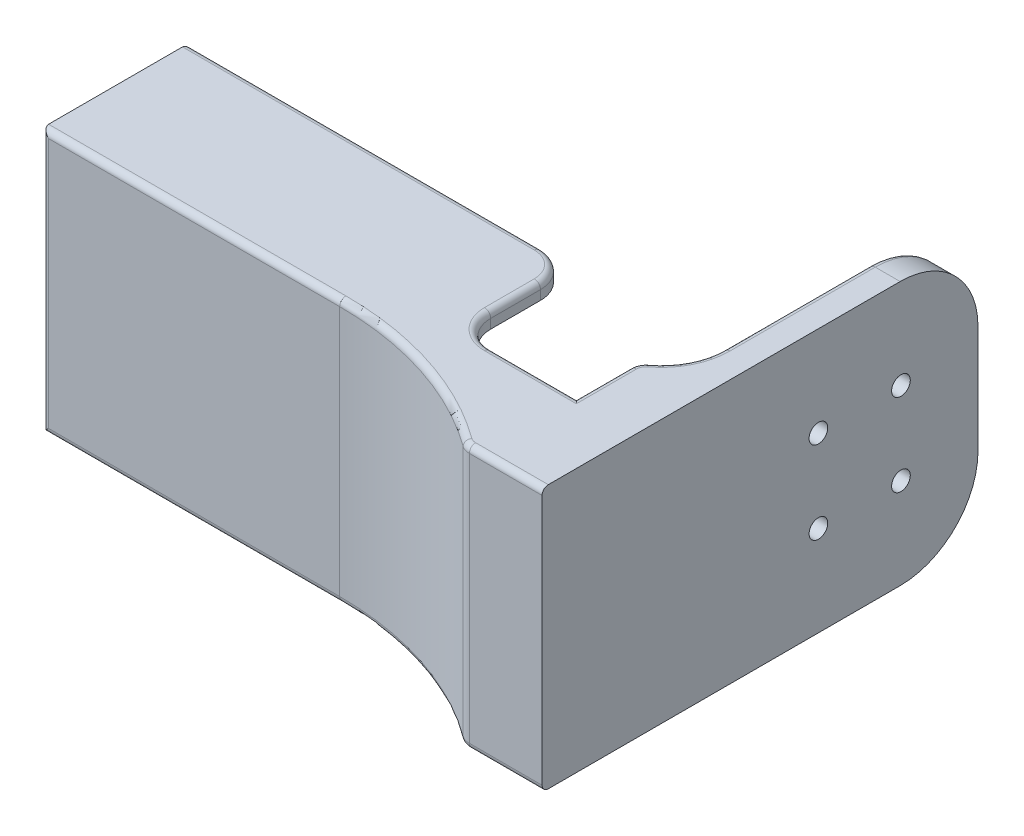
from build123d import *

# Parameters (mm, degrees)
CROQUIS1_W               = 118
CROQUIS1_H               = 84.6
SALIENTE_EXTRUIR1_DEPTH  = 36
CROQUIS2_W               = 36
CROQUIS2_H               = 74.6
CORTAR_EXTRUIR1_DEPTH    = 120
CORTAR_EXTRUIR3_DEPTH    = 110.243581047
SALIENTE_EXTRUIR2_DEPTH  = 84.6
CROQUIS8_W               = 160.5
CROQUIS8_H               = 84.6
SALIENTE_EXTRUIR3_DEPTH  = 5
CROQUIS9_W               = 41
CROQUIS9_H               = 84.6
SALIENTE_EXTRUIR4_DEPTH  = 5
CROQUIS10_W              = 5
CROQUIS10_H              = 84.6
SALIENTE_EXTRUIR5_DEPTH  = 20
REDONDEO2_R              = 10
REDONDEO4_R              = 2
CROQUIS18_W              = 165.5
CROQUIS18_H              = 84.6
SALIENTE_EXTRUIR9_DEPTH  = 6
CROQUIS23_W              = 31
CROQUIS23_H              = 84.6
SALIENTE_EXTRUIR12_DEPTH = 5
CROQUIS19_W              = 120
CROQUIS19_H              = 84.6
SALIENTE_EXTRUIR10_DEPTH = 10
REDONDEO6_R              = 20
REDONDEO9_R              = 5
CROQUIS22_W              = 25
CROQUIS22_H              = 84.6
SALIENTE_EXTRUIR11_DEPTH = 20
REDONDEO7_R              = 100
REDONDEO10_R             = 5
CROQUIS26_R              = 6
CORTAR_EXTRUIR4_DEPTH    = 200.244924653
CROQUIS28_R              = 6
SALIENTE_EXTRUIR14_DEPTH = 5
CROQUIS30_R              = 3
CORTAR_EXTRUIR5_DEPTH    = 195.726834309
REDONDEO11_R             = 25
REDONDEO12_R             = 2
REDONDEO13_R             = 2


with BuildPart() as part:
    # Croquis1 → Saliente-Extruir1 (new body)
    with BuildSketch(Plane.XY):
        Rectangle(CROQUIS1_W, CROQUIS1_H)
    extrude(amount=SALIENTE_EXTRUIR1_DEPTH)

    # Croquis2 → Cortar-Extruir1 (cut)
    with BuildSketch(Plane(origin=(59, 0, 0), x_dir=(0, 0, -1), z_dir=(1, 0, 0))):
        with Locations((-18, 0)):
            Rectangle(CROQUIS2_W, CROQUIS2_H)
    extrude(amount=-CORTAR_EXTRUIR1_DEPTH, mode=Mode.SUBTRACT)


with BuildPart() as cortar_extruir1_piece_1:
    # of the separate pieces the step leaves, piece 1, a body of its own (cortar_extruir1_pieces)
    add(part.part.solids().sort_by_distance((-59, -42.3, 0))[0])


with BuildPart() as cortar_extruir1_piece_2:
    # of the separate pieces the step leaves, piece 2, a body of its own (cortar_extruir1_pieces)
    add(part.part.solids().sort_by_distance((-59, 42.3, 0))[0])


with BuildPart() as cortar_extruir3_tool:
    # Croquis6 → Cortar-Extruir3 (new, through all)
    with BuildSketch(Plane.XZ.offset(42.3)):
        with BuildLine():
            Line((-59, 0), (-59, 36))
            Line((-59, 36), (0, 36))
            ThreePointArc((0, 36), (-33.535731191, 24.614115008), (-59, 0))
        make_face()
    extrude(amount=-CORTAR_EXTRUIR3_DEPTH)


with BuildPart() as cortar_extruir1_piece_1_1:
    add(cortar_extruir1_piece_1.part)

    # Cortar-Extruir3: cut by cortar_extruir3_tool
    add(cortar_extruir3_tool.part, mode=Mode.SUBTRACT)



with BuildPart() as cortar_extruir1_piece_2_1:
    add(cortar_extruir1_piece_2.part)

    # Cortar-Extruir3: cut by cortar_extruir3_tool
    add(cortar_extruir3_tool.part, mode=Mode.SUBTRACT)


with BuildPart() as body_3:
    # Croquis7 → Saliente-Extruir2 (new, through all)
    with BuildSketch(Plane.XZ.offset(-42.3)):
        with BuildLine():
            Line((-59, 0), (-59, 36))
            Line((-59, 36), (0, 36))
            ThreePointArc((0, 36), (-33.535731191, 24.614115008), (-59, 0))
        make_face()
    extrude(amount=SALIENTE_EXTRUIR2_DEPTH)


with BuildPart() as cortar_extruir1_piece_1_2:
    add(cortar_extruir1_piece_1_1.part)

    add(cortar_extruir1_piece_2_1.part)  # Saliente-Extruir3 merges Cortar-Extruir1 piece 2

    add(body_3.part)  # Saliente-Extruir3 merges body 3
    # Croquis8 → Saliente-Extruir3 (add)
    with BuildSketch(Plane.XY.offset(36)):
        with Locations((21.25, 0)):
            Rectangle(CROQUIS8_W, CROQUIS8_H)
    extrude(amount=SALIENTE_EXTRUIR3_DEPTH)

    # Croquis9 → Saliente-Extruir4 (add)
    with BuildSketch(Plane.ZY.offset(59)):
        with Locations((20.5, 0)):
            Rectangle(CROQUIS9_W, CROQUIS9_H)
    extrude(amount=SALIENTE_EXTRUIR4_DEPTH)

    # Croquis10 → Saliente-Extruir5 (add)
    with BuildSketch(Plane(origin=(0, 0, 36), x_dir=(-1, 0, 0), z_dir=(0, 0, -1))):
        with Locations((-99, 0)):
            Rectangle(CROQUIS10_W, CROQUIS10_H)
    extrude(amount=SALIENTE_EXTRUIR5_DEPTH)

    # Redondeo2
    redondeo2_edges = [cortar_extruir1_piece_1_2.edges().sort_by_distance(p)[0] for p in [
        (59, -39.8, 36),
        (59, -39.8, 0),
        (59, 39.8, 36),
        (59, 39.8, 0),
    ]]
    fillet(redondeo2_edges, radius=REDONDEO2_R)

    # Redondeo4
    redondeo4_edges = [cortar_extruir1_piece_1_2.edges().sort_by_distance(p)[0] for p in [
        (-7.5, -42.3, 0),
        (-64, 0, 0),
        (82.75, 42.3, 36),
        (82.75, -42.3, 36),
        (59, -42.3, 18),
        (-7.5, 42.3, 0),
        (56.071067812, -42.3, 2.928932188),
        (59, 42.3, 18),
        (56.071067812, 42.3, 2.928932188),
        (61.928932188, -42.3, 33.071067812),
        (61.928932188, 42.3, 33.071067812),
    ]]
    fillet(redondeo4_edges, radius=REDONDEO4_R)

    # Croquis18 → Saliente-Extruir9 (add)
    with BuildSketch(Plane.XY.offset(41)):
        with Locations((18.75, 0)):
            Rectangle(CROQUIS18_W, CROQUIS18_H)
    extrude(amount=SALIENTE_EXTRUIR9_DEPTH)

    # Croquis23 → Saliente-Extruir12 (add)
    with BuildSketch(Plane(origin=(101.5, 0, 0), x_dir=(0, 0, -1), z_dir=(1, 0, 0))):
        with Locations((-31.5, 0)):
            Rectangle(CROQUIS23_W, CROQUIS23_H)
    extrude(amount=SALIENTE_EXTRUIR12_DEPTH)

    # Croquis19 → Saliente-Extruir10 (add)
    with BuildSketch(Plane(origin=(106.5, 0, 0), x_dir=(0, 0, -1), z_dir=(1, 0, 0))):
        with Locations((13, 0)):
            Rectangle(CROQUIS19_W, CROQUIS19_H)
    extrude(amount=SALIENTE_EXTRUIR10_DEPTH)

    # Redondeo6
    # the kernel refuses this fillet: 20 mm, written as the material it adds along each edge
    with BuildSketch(Plane(origin=(106.5, 42.3, 16), x_dir=(0, 0, -1), z_dir=(0, -1, 0))) as redondeo6_piece_1:
        with BuildLine():
            CenterArc((17.320508076, -20), REDONDEO6_R, 90, 60)
            Line((0, -10), (-0.346410162, -9.8))
            ThreePointArc((-0.346410162, -9.8), (-0.4, -5), (-0.4, 0))
            Line((-0.4, 0), (0, 0.4))
            Line((0, 0.4), (17.320508076, 0.4))
            Line((17.320508076, 0.4), (17.320508076, 0))
        make_face()
    extrude(amount=84.6)

    # Redondeo9
    redondeo9_edges = [cortar_extruir1_piece_1_2.edges().sort_by_distance(p)[0] for p in [
        (96.5, 0, 16),
    ]]
    fillet(redondeo9_edges, radius=REDONDEO9_R)

    # Croquis22 → Saliente-Extruir11 (add)
    with BuildSketch(Plane.XY.offset(47)):
        with Locations((104, 0)):
            Rectangle(CROQUIS22_W, CROQUIS22_H)
    extrude(amount=SALIENTE_EXTRUIR11_DEPTH)

    # Redondeo7
    # the kernel refuses this fillet: 100 mm, written as the material it adds along each edge
    with BuildSketch(Plane(origin=(91.5, 42.3, 47), x_dir=(0, 0, 1), z_dir=(0, -1, 0))) as redondeo7_piece_1:
        with BuildLine():
            CenterArc((100, 60), REDONDEO7_R, 180, 36.869897646)
            Line((0, 60), (-2, 60))
            Line((-2, 60), (-2, 0))
            Line((-2, 0), (0, -2))
            ThreePointArc((0, -2), (10, -2), (18.4, -1.2))
            Line((18.4, -1.2), (20, 0))
        make_face()
    extrude(amount=84.6)

    # Redondeo10
    redondeo10_edges = [cortar_extruir1_piece_1_2.edges().sort_by_distance(p)[0] for p in [
        (91.5, 0, 67),
    ]]
    fillet(redondeo10_edges, radius=REDONDEO10_R)

    # Croquis26 → Cortar-Extruir4 (cut, through all)
    with BuildSketch(Plane(origin=(116.5, 0, 0), x_dir=(0, 0, -1), z_dir=(1, 0, 0))):
        with Locations((21.75, 13.25)):
            Circle(CROQUIS26_R)
        with Locations((48.25, 13.25)):
            Circle(CROQUIS26_R)
        with Locations((48.25, -13.25)):
            Circle(CROQUIS26_R)
        with Locations((21.75, -13.25)):
            Circle(CROQUIS26_R)
    extrude(amount=-CORTAR_EXTRUIR4_DEPTH, mode=Mode.SUBTRACT)

    # Croquis28 → Saliente-Extruir14 (add)
    with BuildSketch(Plane(origin=(116.5, 0, 0), x_dir=(0, 0, -1), z_dir=(1, 0, 0))):
        with Locations((21.75, 13.25)):
            Circle(CROQUIS28_R)
        with Locations((48.25, 13.25)):
            Circle(CROQUIS28_R)
        with Locations((21.75, -13.25)):
            Circle(CROQUIS28_R)
        with Locations((48.25, -13.25)):
            Circle(CROQUIS28_R)
    extrude(amount=-SALIENTE_EXTRUIR14_DEPTH)

    # Croquis30 → Cortar-Extruir5 (cut, through all)
    with BuildSketch(Plane.ZY.offset(-111.5)):
        with Locations((-48.25, 13.25)):
            Circle(CROQUIS30_R)
        with Locations((-21.75, 13.25)):
            Circle(CROQUIS30_R)
        with Locations((-48.25, -13.25)):
            Circle(CROQUIS30_R)
        with Locations((-21.75, -13.25)):
            Circle(CROQUIS30_R)
    extrude(amount=-CORTAR_EXTRUIR5_DEPTH, mode=Mode.SUBTRACT)

    # Redondeo11
    redondeo11_edges = [cortar_extruir1_piece_1_2.edges().sort_by_distance(p)[0] for p in [
        (111.5, -42.3, -73),
        (111.5, 42.3, -73),
    ]]
    fillet(redondeo11_edges, radius=REDONDEO11_R)

    # Redondeo12
    redondeo12_edges = [cortar_extruir1_piece_1_2.edges().sort_by_distance(p)[0] for p in [
        (106.5, -42.3, -24.660254038),
        (104.38854382, 42.3, 7.623763834),
        (104.38854382, -42.3, 7.623763834),
        (96.5, 42.3, 28.339745962),
        (97.027864045, 42.3, 16.443423947),
        (96.5, -42.3, 28.339745962),
        (97.027864045, -42.3, 16.443423947),
        (106.5, 0, -73),
        (106.5, 42.3, -24.660254038),
        (106.5, 34.97766953, -65.67766953),
        (106.5, -34.97766953, -65.67766953),
    ]]
    fillet(redondeo12_edges, radius=REDONDEO12_R)

    # Redondeo13
    redondeo13_edges = [cortar_extruir1_piece_1_2.edges().sort_by_distance(p)[0] for p in [
        (-64, 0, 47),
        (-16.25, -42.3, 47),
        (104.822070015, 42.3, 67),
        (-16.25, 42.3, 47),
        (62.360669992, 42.3, 51.881026879),
        (104.822070015, -42.3, 67),
        (62.360669992, -42.3, 51.881026879),
        (91.60110653, -42.3, 66.755948656),
        (91.60110653, 42.3, 66.755948656),
    ]]
    fillet(redondeo13_edges, radius=REDONDEO13_R)


solid = cortar_extruir1_piece_1_2.part
